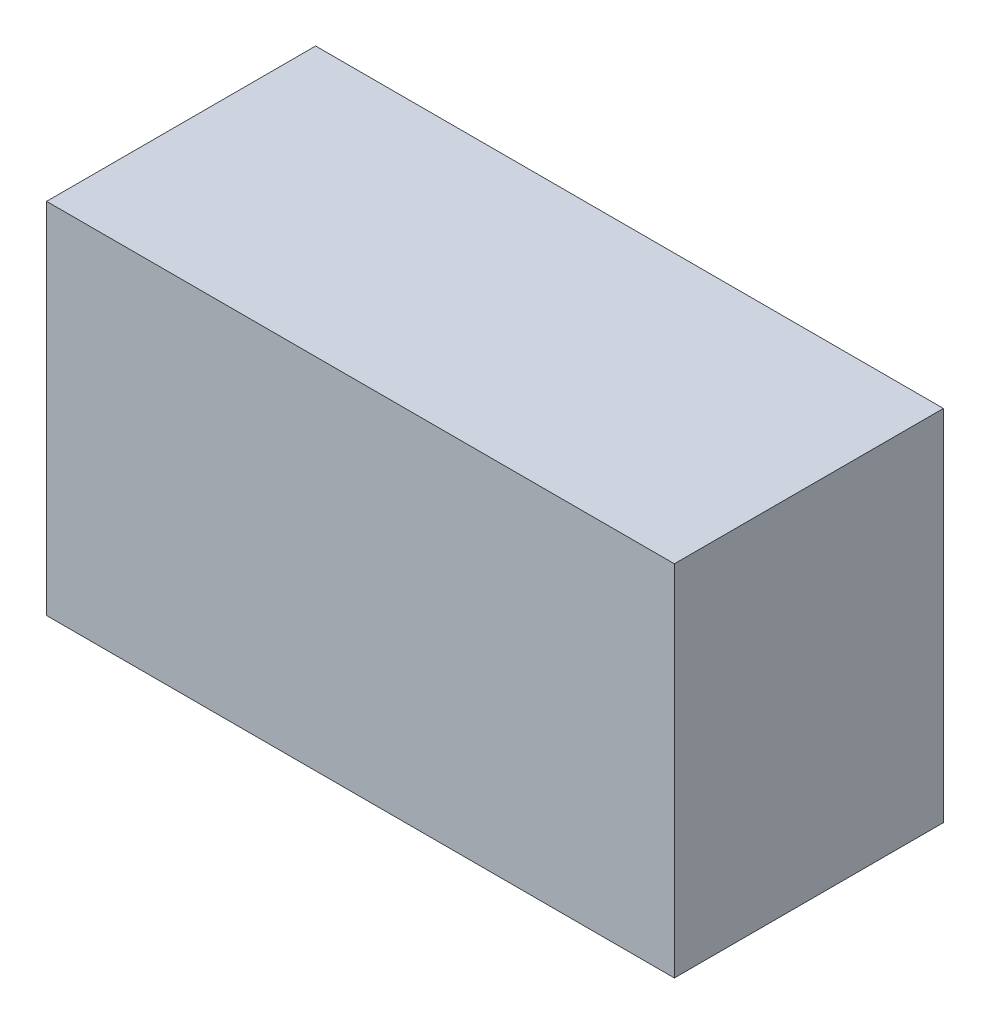
from build123d import *

# Parameters (mm, degrees)
SKETCH_1_W      = 70
SKETCH_1_H      = 40
EXTRUDE_1_DEPTH = 30


with BuildPart() as part:
    # 草图1 → 凸台-拉伸1 (new body)
    with BuildSketch(Plane.XY):
        Rectangle(SKETCH_1_W, SKETCH_1_H)
    extrude(amount=EXTRUDE_1_DEPTH)


solid = part.part
